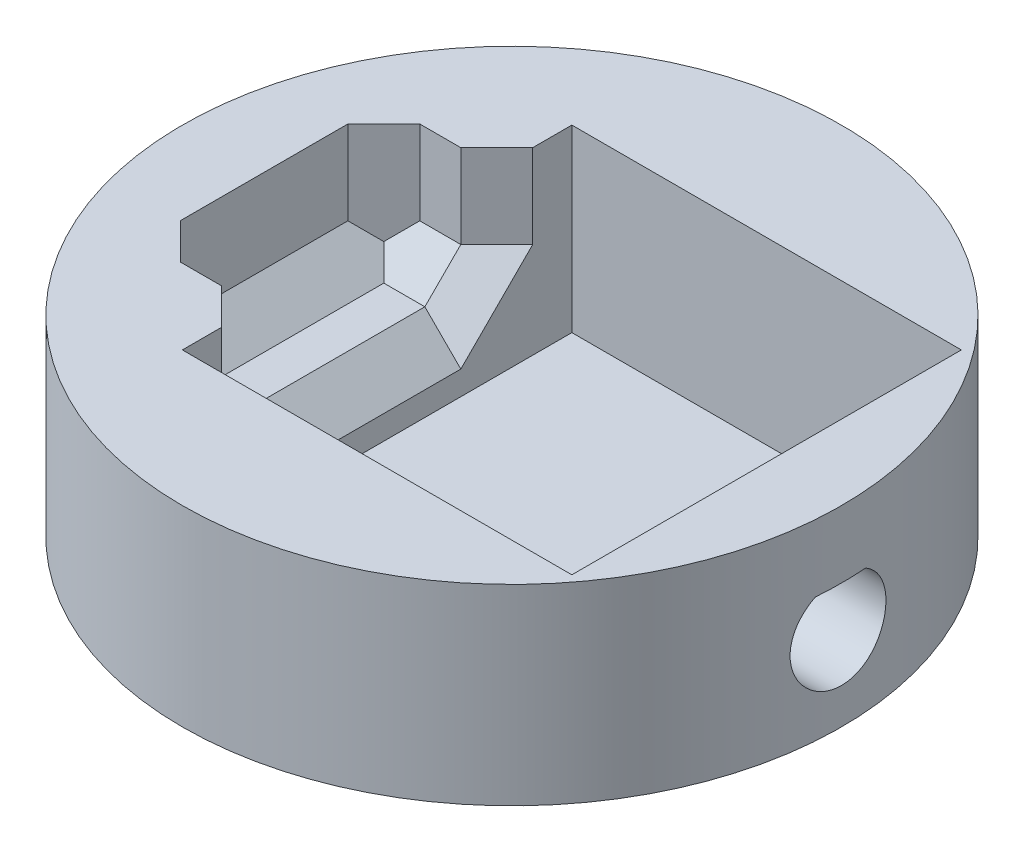
from build123d import *

# Parameters (mm, degrees)
SKETCH1_R           = 27.5
BOSS_EXTRUDE1_DEPTH = 16
CUT_EXTRUDE1_DEPTH  = 15
CUT_EXTRUDE2_DEPTH  = 15
SKETCH6_W           = 18.849176954
SKETCH6_H           = 19.96776686
CUT_EXTRUDE4_DEPTH  = 10
CHAMFER2_SIZE       = 3
CHAMFER3_SIZE       = 3


with BuildPart() as part:
    # Sketch1 → Boss-Extrude1 (new body)
    with BuildSketch(Plane(origin=(0, 0, 0), x_dir=(1, 0, 0), z_dir=(0, 1, 0))):
        Circle(SKETCH1_R)
    extrude(amount=BOSS_EXTRUDE1_DEPTH)

    # Sketch3 → Cut-Extrude1 (cut)
    with BuildSketch(Plane(origin=(0, 16, 0), x_dir=(1, 0, 0), z_dir=(0, 1, 0))):
        Polygon((-11.25, -16.25), (16.25, -16.25), (21.25, -16.25), (21.25, 16.25), (16.25, 16.25), (-11.25, 16.25), align=None)
    extrude(amount=-CUT_EXTRUDE1_DEPTH, mode=Mode.SUBTRACT)

    # Sketch4 → Cut-Extrude2 (cut)
    with BuildSketch(Plane.ZY.offset(-21.25)):
        with BuildLine():
            Line((-2.103243144, 10.402406248), (2.103243144, 10.402406248))
            ThreePointArc((2.103243144, 10.402406248), (0, 3), (-2.103243144, 10.402406248))
        make_face()
    extrude(amount=-CUT_EXTRUDE2_DEPTH, mode=Mode.SUBTRACT)

    # Sketch6 → Cut-Extrude4 (cut)
    with BuildSketch(Plane(origin=(0, 16, 0), x_dir=(1, 0, 0), z_dir=(0, 1, 0))):
        with Locations((-11.25, 0)):
            Rectangle(SKETCH6_W, SKETCH6_H)
    extrude(amount=-CUT_EXTRUDE4_DEPTH, mode=Mode.SUBTRACT)

    # Chamfer2
    chamfer2_edges = [part.edges().sort_by_distance(p)[0] for p in [
        (-15.962294239, 6, 9.98388343),
        (-20.674588477, 6, 0),
        (-15.962294239, 6, -9.98388343),
        (-11.25, 11, 9.98388343),
        (-11.25, 11, -9.98388343),
        (-11.25, 6, 0),
    ]]
    chamfer(chamfer2_edges, length=CHAMFER2_SIZE)

    # Chamfer3
    chamfer3_edges = [part.edges().sort_by_distance(p)[0] for p in [
        (-20.674588477, 12.5, -9.98388343),
        (-20.674588477, 12.5, 9.98388343),
    ]]
    chamfer(chamfer3_edges, length=CHAMFER3_SIZE)


solid = part.part
